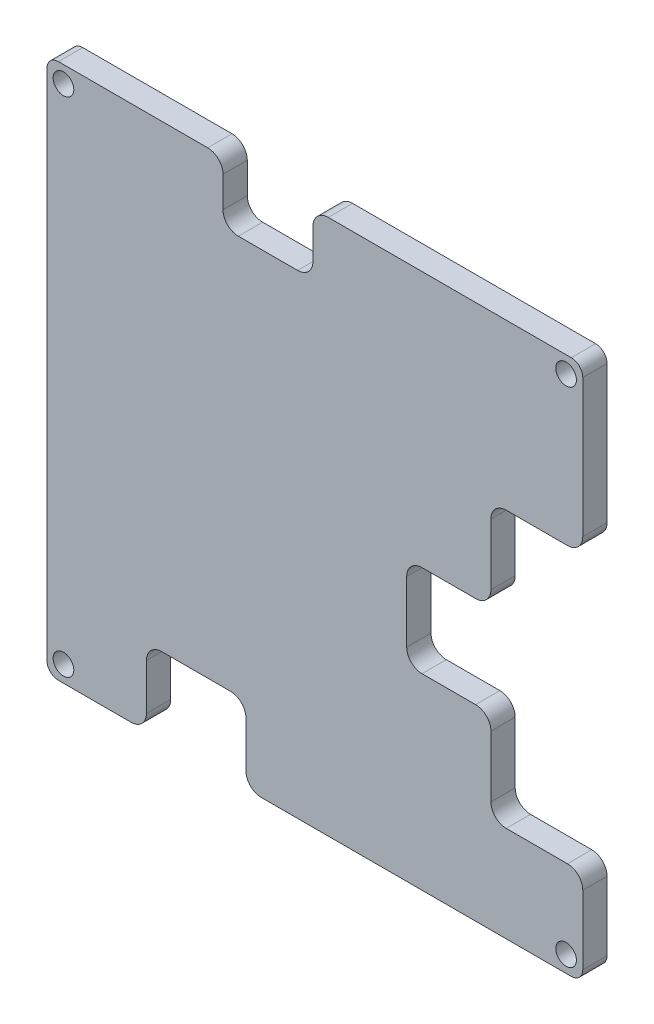
from build123d import *

# Parameters (mm, degrees)
SKETCH1_W               = 70
SKETCH1_H               = 70
SKETCH1_R               = 1.35
BOSS_EXTRUDE1_DEPTH     = 3.175
FILLET1_R               = 1.5
CUT_EXTRUDE1_DEPTH      = 50.599199842
CUT_EXTRUDE1_DEPTH_BACK = 50.599199842
FILLET2_R               = 2
CUT_EXTRUDE2_DEPTH      = 50.599199842
CUT_EXTRUDE2_DEPTH_BACK = 50.599199842
SKETCH3_W               = 13
SKETCH3_H               = 10
SKETCH3_W_2             = 11.75
SKETCH3_H_2             = 8
FILLET3_R               = 2


with BuildPart() as part:
    # Sketch1 → Boss-Extrude1 (new body)
    with BuildSketch(Plane.XY):
        Rectangle(SKETCH1_W, SKETCH1_H)
        with Locations((-32.84, 32.82)):
            Circle(SKETCH1_R, mode=Mode.SUBTRACT)
        with Locations((-32.84, -32.84)):
            Circle(SKETCH1_R, mode=Mode.SUBTRACT)
        with Locations((32.82, -32.84)):
            Circle(SKETCH1_R, mode=Mode.SUBTRACT)
        with Locations((32.82, 32.82)):
            Circle(SKETCH1_R, mode=Mode.SUBTRACT)
    extrude(amount=BOSS_EXTRUDE1_DEPTH)

    # Fillet1
    fillet1_edges = [part.edges().sort_by_distance(p)[0] for p in [
        (35, 35, 1.5875),
        (35, -35, 1.5875),
        (-35, -35, 1.5875),
        (-35, 35, 1.5875),
    ]]
    fillet(fillet1_edges, radius=FILLET1_R)

    # Sketch2 → Cut-Extrude1 (cut, two sides: drawn at the far end of the back side and taken through both)
    with BuildSketch(Plane(origin=(0, 0, 0), x_dir=(-1, 0, 0), z_dir=(0, 0, -1)).offset(-CUT_EXTRUDE1_DEPTH_BACK)):
        Polygon((-35, 13.5), (-23, 13.5), (-23, 1.5), (-12, 1.5), (-12, -10.5), (-23, -10.5), (-23, -22.5), (-35, -22.5), align=None)
    extrude(amount=CUT_EXTRUDE1_DEPTH + CUT_EXTRUDE1_DEPTH_BACK, mode=Mode.SUBTRACT)

    # Fillet2
    fillet2_edges = [part.edges().sort_by_distance(p)[0] for p in [
        (23, 13.5, 1.5875),
        (12, -10.5, 1.5875),
        (12, 1.5, 1.5875),
        (23, -22.5, 1.5875),
        (35, -22.5, 1.5875),
        (35, 13.5, 1.5875),
        (23, -10.5, 1.5875),
        (23, 1.5, 1.5875),
    ]]
    fillet(fillet2_edges, radius=FILLET2_R)

    # Sketch3 → Cut-Extrude2 (cut, two sides: drawn at the far end of the back side and taken through both)
    with BuildSketch(Plane(origin=(0, 0, 0), x_dir=(-1, 0, 0), z_dir=(0, 0, -1)).offset(-CUT_EXTRUDE2_DEPTH_BACK)):
        with Locations((15.5, -30)):
            Rectangle(SKETCH3_W, SKETCH3_H)
        with Locations((6.125, 31)):
            Rectangle(SKETCH3_W_2, SKETCH3_H_2)
    extrude(amount=CUT_EXTRUDE2_DEPTH + CUT_EXTRUDE2_DEPTH_BACK, mode=Mode.SUBTRACT)

    # Fillet3
    fillet3_edges = [part.edges().sort_by_distance(p)[0] for p in [
        (-9, -35, 1.5875),
        (-22, -35, 1.5875),
        (-22, -25, 1.5875),
        (-9, -25, 1.5875),
        (-12, 27, 1.5875),
        (-0.25, 27, 1.5875),
        (-0.25, 35, 1.5875),
        (-12, 35, 1.5875),
    ]]
    fillet(fillet3_edges, radius=FILLET3_R)


solid = part.part
